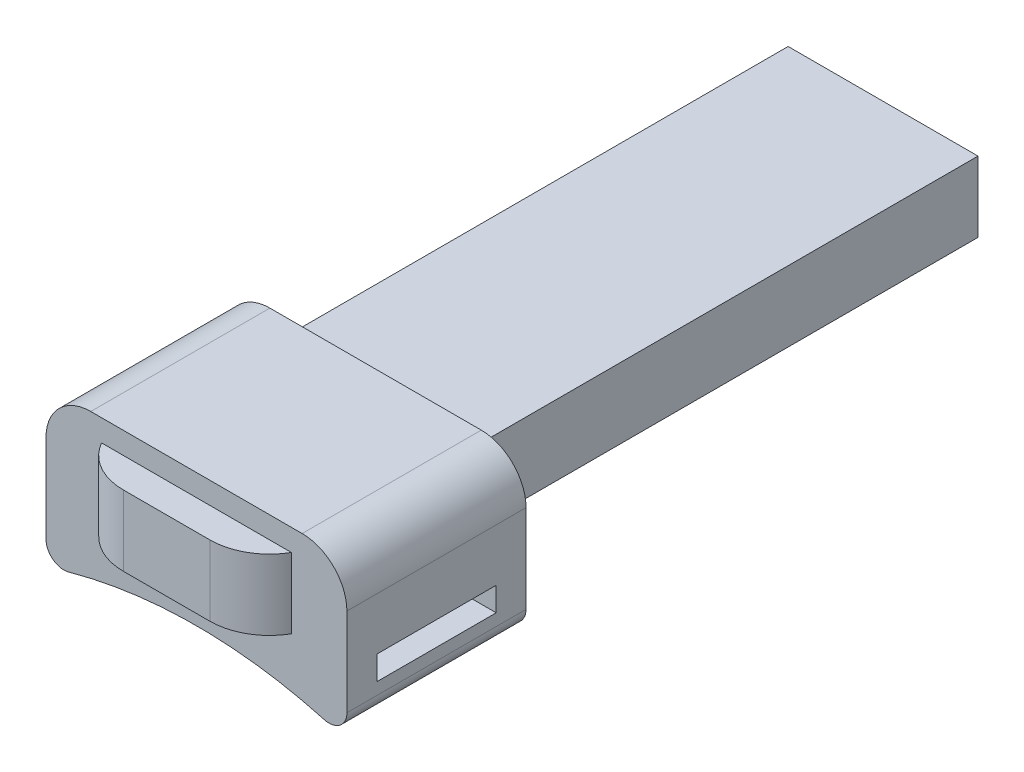
from build123d import *

# Parameters (mm, degrees)
BOSS_EXTRUDE1_DEPTH = 120
BOSS_EXTRUDE2_DEPTH = 30
FILLET1_R           = 10
FILLET2_R           = 10
CUT_EXTRUDE1_DEPTH  = 85


with BuildPart() as part:
    # Sketch1 → Boss-Extrude1 (new body)
    with BuildSketch(Plane.XY):
        Polygon((0, 0), (15.9, 0), (15.9, 11.8), (-15.9, 11.8), (-15.9, 0), align=None)
    extrude(amount=-BOSS_EXTRUDE1_DEPTH)

    # Sketch2 → Boss-Extrude2 (add)
    with BuildSketch(Plane.XY.offset(-5)):
        with BuildLine():
            Line((-15.9, 15.45), (17.7, 15.45))
            ThreePointArc((17.7, 15.45), (23.003300859, 13.253300859), (25.2, 7.95))
            Line((25.2, 7.95), (25.2, -4.05))
            Line((25.2, -4.05), (25.2, -6.799114346))
            ThreePointArc((25.2, -6.799114346), (24.015595093, -9.187338468), (21.397590361, -9.689813011))
            ThreePointArc((21.397590361, -9.689813011), (0, -6.775110745), (-21.397590361, -9.689813011))
            ThreePointArc((-21.397590361, -9.689813011), (-24.015595093, -9.187338468), (-25.2, -6.799114346))
            Line((-25.2, -6.799114346), (-25.2, -4.05))
            Line((-25.2, -4.05), (-25.2, 7.95))
            ThreePointArc((-25.2, 7.95), (-23.003300859, 13.253300859), (-17.7, 15.45))
            Line((-17.7, 15.45), (-15.9, 15.45))
        make_face()
    extrude(amount=-BOSS_EXTRUDE2_DEPTH)

    # Fillet1
    # the kernel refuses this fillet: 10 mm, written as the material it takes off along each edge
    with BuildSketch(Plane(origin=(15.9, -21.650635095, 0), x_dir=(0, 0, -1), z_dir=(0, 1, 0))) as fillet1_piece_1:
        with BuildLine():
            CenterArc((10, 8.660254038), FILLET1_R, 180, 60)
            Line((0, 8.660254038), (-0.2, 8.660254038))
            Line((-0.2, 8.660254038), (-0.2, 0))
            Line((-0.2, 0), (0, -0.2))
            ThreePointArc((0, -0.2), (2.5, -0.2), (4.9, -0.173205081))
            Line((4.9, -0.173205081), (5, 0))
        make_face()
    extrude(amount=55.101270189, mode=Mode.SUBTRACT)

    # Fillet2
    # the kernel refuses this fillet: 10 mm, written as the material it takes off along each edge
    with BuildSketch(Plane(origin=(-15.9, 33.450635095, 0), x_dir=(1, 0, 0), z_dir=(0, -1, 0))) as fillet2_piece_1:
        with BuildLine():
            CenterArc((8.660254038, -10), FILLET2_R, 90, 60)
            Line((0, -5), (-0.173205081, -4.9))
            ThreePointArc((-0.173205081, -4.9), (-0.2, -2.5), (-0.2, 0))
            Line((-0.2, 0), (0, 0.2))
            Line((0, 0.2), (8.660254038, 0.2))
            Line((8.660254038, 0.2), (8.660254038, 0))
        make_face()
    extrude(amount=55.101270189, mode=Mode.SUBTRACT)

    # Sketch3 → Cut-Extrude1 (cut)
    with BuildSketch(Plane(origin=(25.2, 0, 0), x_dir=(0, 0, -1), z_dir=(1, 0, 0))):
        Polygon((20, -4.799114346), (30, -4.799114346), (30, -0.799114346), (10, -0.799114346), (10, -4.799114346), align=None)
    extrude(amount=-CUT_EXTRUDE1_DEPTH, mode=Mode.SUBTRACT)


solid = part.part
